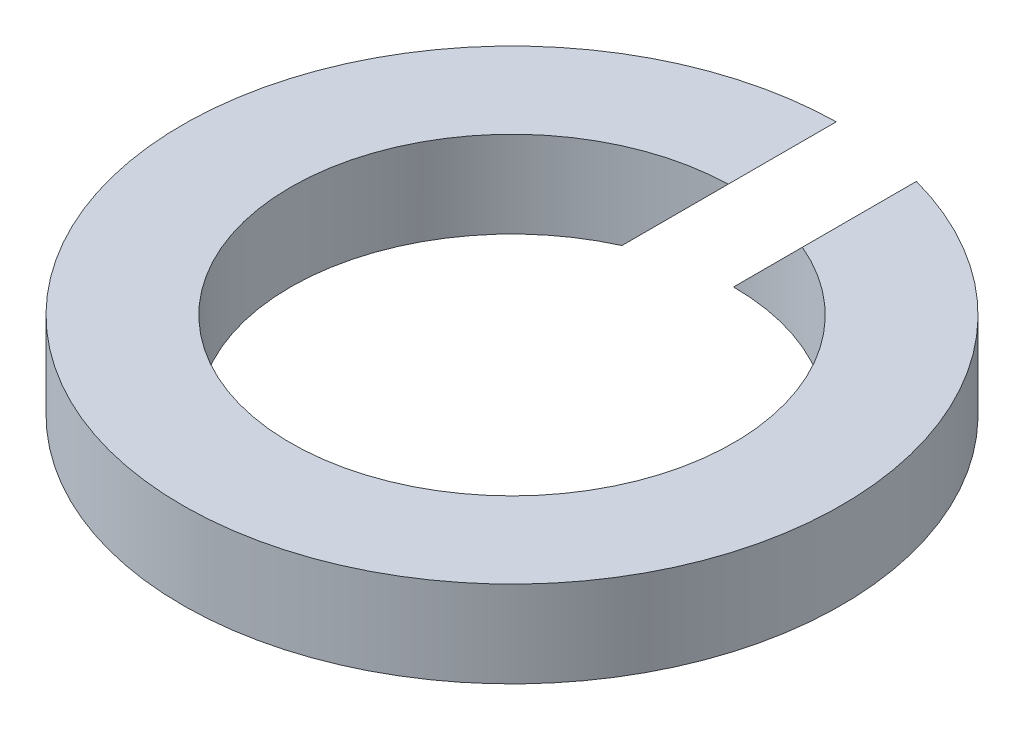
from build123d import *

# Parameters (mm, degrees)
SKETCH_1_R          = 6.1
SKETCH_1_R_2        = 4.1
EXTRUDE_1_DEPTH     = 1.6
CUT_EXTRUDE_1_DEPTH = 9.773824708


with BuildPart() as part:
    # Эскиз1 → Бобышка-Вытянуть1 (new body)
    with BuildSketch(Plane(origin=(0, 0, 0), x_dir=(1, 0, 0), z_dir=(0, 1, 0))):
        Circle(SKETCH_1_R)
        Circle(SKETCH_1_R_2, mode=Mode.SUBTRACT)
    extrude(amount=EXTRUDE_1_DEPTH)

    # Эскиз2 → Вырез-Вытянуть1 (cut, through all)
    with BuildSketch(Plane.XY):
        Polygon((0, 0), (1.6, 1.6), (-0.097056275, 1.6), (-1.697056275, 0), align=None)
    extrude(amount=-CUT_EXTRUDE_1_DEPTH, mode=Mode.SUBTRACT)


solid = part.part
